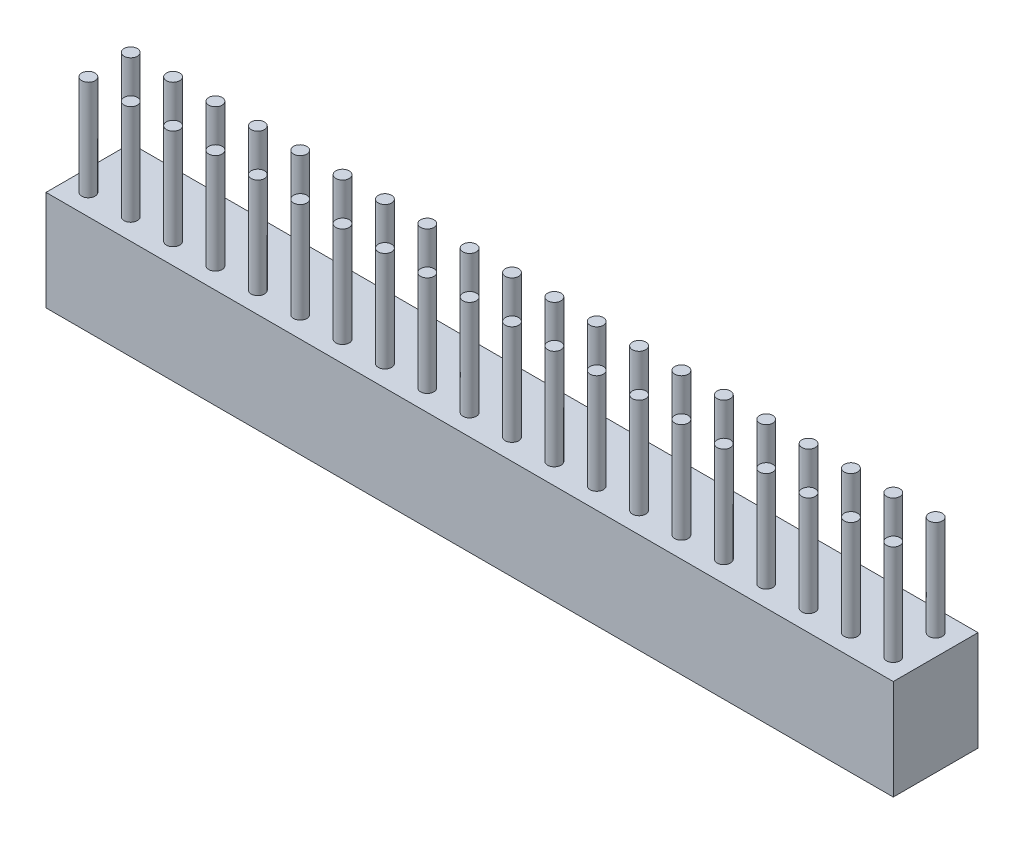
from build123d import *

# Parameters (mm, degrees)
SKETCH1_W             = 2.54
SKETCH1_H             = 2.54
BOSS_EXTRUDE1_DEPTH   = 6
SKETCH2_R             = 0.4
BOSS_EXTRUDE2_DEPTH   = 6
SKETCH3_W             = 1
SKETCH3_H             = 1
CUT_EXTRUDE1_DEPTH    = 3
LPATTERN1_START       = -6
LPATTERN1_OUTLINE_W   = 1
LPATTERN1_OUTLINE_H   = 1
LPATTERN1_DEPTH       = 6
LPATTERN1_START_2     = -3
LPATTERN1_2_OUTLINE_R = 0.4
LPATTERN1_2_DEPTH     = 9
LPATTERN1_3_OUTLINE_W = 1
LPATTERN1_3_OUTLINE_H = 1
LPATTERN1_3_OUTLINE_R = 0.4
LPATTERN1_3_DEPTH     = 3


# Read off the part's stored shape, not the designer's step: LPattern1
with BuildPart() as part:
    # Sketch1 → Boss-Extrude1 (new body)
    with BuildSketch(Plane(origin=(0, 0, 0), x_dir=(1, 0, 0), z_dir=(0, 1, 0))):
        Rectangle(SKETCH1_W, SKETCH1_H)
    extrude(amount=-BOSS_EXTRUDE1_DEPTH)

    # Sketch2 → Boss-Extrude2 (add)
    with BuildSketch(Plane(origin=(0, 0, 0), x_dir=(1, 0, 0), z_dir=(0, 1, 0))):
        with Locations(Location((0, 0, 0), (0, 0, 270))):
            Circle(SKETCH2_R)
    extrude(amount=BOSS_EXTRUDE2_DEPTH)

    # Sketch3 → Cut-Extrude1 (cut)
    with BuildSketch(Plane.XZ.offset(6)):
        Rectangle(SKETCH3_W, SKETCH3_H)
    extrude(amount=-CUT_EXTRUDE1_DEPTH, mode=Mode.SUBTRACT)

    # LPattern1 outline → LPattern1 (add)
    with BuildSketch(Plane(origin=(0, 0, 0), x_dir=(1, 0, 0), z_dir=(0, 1, 0)).offset(LPATTERN1_START)):
        Polygon((-1.27, -1.27), (-1.27, -3.81), (49.53, -3.81), (49.53, 1.27), (1.27, 1.27), (1.27, -1.27), align=None)
        with Locations((0, -2.54)):
            Rectangle(LPATTERN1_OUTLINE_W, LPATTERN1_OUTLINE_H, mode=Mode.SUBTRACT)
        with Locations((2.54, -2.54)):
            Rectangle(LPATTERN1_OUTLINE_W, LPATTERN1_OUTLINE_H, mode=Mode.SUBTRACT)
        with Locations((5.08, -2.54)):
            Rectangle(LPATTERN1_OUTLINE_W, LPATTERN1_OUTLINE_H, mode=Mode.SUBTRACT)
        with Locations((7.62, -2.54)):
            Rectangle(LPATTERN1_OUTLINE_W, LPATTERN1_OUTLINE_H, mode=Mode.SUBTRACT)
        with Locations((10.16, -2.54)):
            Rectangle(LPATTERN1_OUTLINE_W, LPATTERN1_OUTLINE_H, mode=Mode.SUBTRACT)
        with Locations((12.7, -2.54)):
            Rectangle(LPATTERN1_OUTLINE_W, LPATTERN1_OUTLINE_H, mode=Mode.SUBTRACT)
        with Locations((15.24, -2.54)):
            Rectangle(LPATTERN1_OUTLINE_W, LPATTERN1_OUTLINE_H, mode=Mode.SUBTRACT)
        with Locations((17.78, -2.54)):
            Rectangle(LPATTERN1_OUTLINE_W, LPATTERN1_OUTLINE_H, mode=Mode.SUBTRACT)
        with Locations((20.32, -2.54)):
            Rectangle(LPATTERN1_OUTLINE_W, LPATTERN1_OUTLINE_H, mode=Mode.SUBTRACT)
        with Locations((22.86, -2.54)):
            Rectangle(LPATTERN1_OUTLINE_W, LPATTERN1_OUTLINE_H, mode=Mode.SUBTRACT)
        with Locations((25.4, -2.54)):
            Rectangle(LPATTERN1_OUTLINE_W, LPATTERN1_OUTLINE_H, mode=Mode.SUBTRACT)
        with Locations((27.94, -2.54)):
            Rectangle(LPATTERN1_OUTLINE_W, LPATTERN1_OUTLINE_H, mode=Mode.SUBTRACT)
        with Locations((30.48, -2.54)):
            Rectangle(LPATTERN1_OUTLINE_W, LPATTERN1_OUTLINE_H, mode=Mode.SUBTRACT)
        with Locations((33.02, -2.54)):
            Rectangle(LPATTERN1_OUTLINE_W, LPATTERN1_OUTLINE_H, mode=Mode.SUBTRACT)
        with Locations((35.56, -2.54)):
            Rectangle(LPATTERN1_OUTLINE_W, LPATTERN1_OUTLINE_H, mode=Mode.SUBTRACT)
        with Locations((38.1, -2.54)):
            Rectangle(LPATTERN1_OUTLINE_W, LPATTERN1_OUTLINE_H, mode=Mode.SUBTRACT)
        with Locations((40.64, -2.54)):
            Rectangle(LPATTERN1_OUTLINE_W, LPATTERN1_OUTLINE_H, mode=Mode.SUBTRACT)
        with Locations((43.18, -2.54)):
            Rectangle(LPATTERN1_OUTLINE_W, LPATTERN1_OUTLINE_H, mode=Mode.SUBTRACT)
        with Locations((45.72, -2.54)):
            Rectangle(LPATTERN1_OUTLINE_W, LPATTERN1_OUTLINE_H, mode=Mode.SUBTRACT)
        with Locations((48.26, -2.54)):
            Rectangle(LPATTERN1_OUTLINE_W, LPATTERN1_OUTLINE_H, mode=Mode.SUBTRACT)
        with Locations((2.54, 0)):
            Rectangle(LPATTERN1_OUTLINE_W, LPATTERN1_OUTLINE_H, mode=Mode.SUBTRACT)
        with Locations((5.08, 0)):
            Rectangle(LPATTERN1_OUTLINE_W, LPATTERN1_OUTLINE_H, mode=Mode.SUBTRACT)
        with Locations((7.62, 0)):
            Rectangle(LPATTERN1_OUTLINE_W, LPATTERN1_OUTLINE_H, mode=Mode.SUBTRACT)
        with Locations((10.16, 0)):
            Rectangle(LPATTERN1_OUTLINE_W, LPATTERN1_OUTLINE_H, mode=Mode.SUBTRACT)
        with Locations((12.7, 0)):
            Rectangle(LPATTERN1_OUTLINE_W, LPATTERN1_OUTLINE_H, mode=Mode.SUBTRACT)
        with Locations((15.24, 0)):
            Rectangle(LPATTERN1_OUTLINE_W, LPATTERN1_OUTLINE_H, mode=Mode.SUBTRACT)
        with Locations((17.78, 0)):
            Rectangle(LPATTERN1_OUTLINE_W, LPATTERN1_OUTLINE_H, mode=Mode.SUBTRACT)
        with Locations((20.32, 0)):
            Rectangle(LPATTERN1_OUTLINE_W, LPATTERN1_OUTLINE_H, mode=Mode.SUBTRACT)
        with Locations((22.86, 0)):
            Rectangle(LPATTERN1_OUTLINE_W, LPATTERN1_OUTLINE_H, mode=Mode.SUBTRACT)
        with Locations((25.4, 0)):
            Rectangle(LPATTERN1_OUTLINE_W, LPATTERN1_OUTLINE_H, mode=Mode.SUBTRACT)
        with Locations((27.94, 0)):
            Rectangle(LPATTERN1_OUTLINE_W, LPATTERN1_OUTLINE_H, mode=Mode.SUBTRACT)
        with Locations((30.48, 0)):
            Rectangle(LPATTERN1_OUTLINE_W, LPATTERN1_OUTLINE_H, mode=Mode.SUBTRACT)
        with Locations((33.02, 0)):
            Rectangle(LPATTERN1_OUTLINE_W, LPATTERN1_OUTLINE_H, mode=Mode.SUBTRACT)
        with Locations((35.56, 0)):
            Rectangle(LPATTERN1_OUTLINE_W, LPATTERN1_OUTLINE_H, mode=Mode.SUBTRACT)
        with Locations((38.1, 0)):
            Rectangle(LPATTERN1_OUTLINE_W, LPATTERN1_OUTLINE_H, mode=Mode.SUBTRACT)
        with Locations((40.64, 0)):
            Rectangle(LPATTERN1_OUTLINE_W, LPATTERN1_OUTLINE_H, mode=Mode.SUBTRACT)
        with Locations((43.18, 0)):
            Rectangle(LPATTERN1_OUTLINE_W, LPATTERN1_OUTLINE_H, mode=Mode.SUBTRACT)
        with Locations((45.72, 0)):
            Rectangle(LPATTERN1_OUTLINE_W, LPATTERN1_OUTLINE_H, mode=Mode.SUBTRACT)
        with Locations((48.26, 0)):
            Rectangle(LPATTERN1_OUTLINE_W, LPATTERN1_OUTLINE_H, mode=Mode.SUBTRACT)
    extrude(amount=LPATTERN1_DEPTH)



with BuildPart() as body_2:
    # LPattern1 2 outline → LPattern1 2 (new body)
    with BuildSketch(Plane(origin=(0, 0, 0), x_dir=(1, 0, 0), z_dir=(0, 1, 0)).offset(LPATTERN1_START_2)):
        with Locations((48.26, -2.54)):
            Circle(LPATTERN1_2_OUTLINE_R)
        with Locations((45.72, -2.54)):
            Circle(LPATTERN1_2_OUTLINE_R)
        with Locations((43.18, -2.54)):
            Circle(LPATTERN1_2_OUTLINE_R)
        with Locations((40.64, -2.54)):
            Circle(LPATTERN1_2_OUTLINE_R)
        with Locations((38.1, -2.54)):
            Circle(LPATTERN1_2_OUTLINE_R)
        with Locations((35.56, -2.54)):
            Circle(LPATTERN1_2_OUTLINE_R)
        with Locations((33.02, -2.54)):
            Circle(LPATTERN1_2_OUTLINE_R)
        with Locations((30.48, -2.54)):
            Circle(LPATTERN1_2_OUTLINE_R)
        with Locations((27.94, -2.54)):
            Circle(LPATTERN1_2_OUTLINE_R)
        with Locations((25.4, -2.54)):
            Circle(LPATTERN1_2_OUTLINE_R)
        with Locations((22.86, -2.54)):
            Circle(LPATTERN1_2_OUTLINE_R)
        with Locations((20.32, -2.54)):
            Circle(LPATTERN1_2_OUTLINE_R)
        with Locations((17.78, -2.54)):
            Circle(LPATTERN1_2_OUTLINE_R)
        with Locations((15.24, -2.54)):
            Circle(LPATTERN1_2_OUTLINE_R)
        with Locations((12.7, -2.54)):
            Circle(LPATTERN1_2_OUTLINE_R)
        with Locations((10.16, -2.54)):
            Circle(LPATTERN1_2_OUTLINE_R)
        with Locations((7.62, -2.54)):
            Circle(LPATTERN1_2_OUTLINE_R)
        with Locations((5.08, -2.54)):
            Circle(LPATTERN1_2_OUTLINE_R)
        with Locations((2.54, -2.54)):
            Circle(LPATTERN1_2_OUTLINE_R)
        with Locations((0, -2.54)):
            Circle(LPATTERN1_2_OUTLINE_R)
        with Locations((48.26, 0)):
            Circle(LPATTERN1_2_OUTLINE_R)
        with Locations((45.72, 0)):
            Circle(LPATTERN1_2_OUTLINE_R)
        with Locations((43.18, 0)):
            Circle(LPATTERN1_2_OUTLINE_R)
        with Locations((40.64, 0)):
            Circle(LPATTERN1_2_OUTLINE_R)
        with Locations((38.1, 0)):
            Circle(LPATTERN1_2_OUTLINE_R)
        with Locations((35.56, 0)):
            Circle(LPATTERN1_2_OUTLINE_R)
        with Locations((33.02, 0)):
            Circle(LPATTERN1_2_OUTLINE_R)
        with Locations((30.48, 0)):
            Circle(LPATTERN1_2_OUTLINE_R)
        with Locations((27.94, 0)):
            Circle(LPATTERN1_2_OUTLINE_R)
        with Locations((25.4, 0)):
            Circle(LPATTERN1_2_OUTLINE_R)
        with Locations((22.86, 0)):
            Circle(LPATTERN1_2_OUTLINE_R)
        with Locations((20.32, 0)):
            Circle(LPATTERN1_2_OUTLINE_R)
        with Locations((17.78, 0)):
            Circle(LPATTERN1_2_OUTLINE_R)
        with Locations((15.24, 0)):
            Circle(LPATTERN1_2_OUTLINE_R)
        with Locations((12.7, 0)):
            Circle(LPATTERN1_2_OUTLINE_R)
        with Locations((10.16, 0)):
            Circle(LPATTERN1_2_OUTLINE_R)
        with Locations((7.62, 0)):
            Circle(LPATTERN1_2_OUTLINE_R)
        with Locations((5.08, 0)):
            Circle(LPATTERN1_2_OUTLINE_R)
        with Locations((2.54, 0)):
            Circle(LPATTERN1_2_OUTLINE_R)
    extrude(amount=LPATTERN1_2_DEPTH)


with BuildPart() as part_1:
    add(part.part)

    add(body_2.part)  # LPattern1 3 merges body 2
    # LPattern1 3 outline → LPattern1 3 (add)
    # profile 1 of 39: a face of its own
    with BuildSketch(Plane(origin=(0, 0, 0), x_dir=(1, 0, 0), z_dir=(0, 1, 0)).offset(LPATTERN1_START_2)):
        with Locations((0, -2.54)):
            Rectangle(LPATTERN1_3_OUTLINE_W, LPATTERN1_3_OUTLINE_H)
        with Locations((0, -2.54)):
            Circle(LPATTERN1_3_OUTLINE_R, mode=Mode.SUBTRACT)
    # profile 2 of 39: a face of its own
    with BuildSketch(Plane(origin=(0, 0, 0), x_dir=(1, 0, 0), z_dir=(0, 1, 0)).offset(LPATTERN1_START_2)):
        with Locations((48.26, 0)):
            Rectangle(LPATTERN1_3_OUTLINE_W, LPATTERN1_3_OUTLINE_H)
        with Locations((48.26, 0)):
            Circle(LPATTERN1_3_OUTLINE_R, mode=Mode.SUBTRACT)
    # profile 3 of 39: a face of its own
    with BuildSketch(Plane(origin=(0, 0, 0), x_dir=(1, 0, 0), z_dir=(0, 1, 0)).offset(LPATTERN1_START_2)):
        with Locations((45.72, 0)):
            Rectangle(LPATTERN1_3_OUTLINE_W, LPATTERN1_3_OUTLINE_H)
        with Locations((45.72, 0)):
            Circle(LPATTERN1_3_OUTLINE_R, mode=Mode.SUBTRACT)
    # profile 4 of 39: a face of its own
    with BuildSketch(Plane(origin=(0, 0, 0), x_dir=(1, 0, 0), z_dir=(0, 1, 0)).offset(LPATTERN1_START_2)):
        with Locations((43.18, 0)):
            Rectangle(LPATTERN1_3_OUTLINE_W, LPATTERN1_3_OUTLINE_H)
        with Locations((43.18, 0)):
            Circle(LPATTERN1_3_OUTLINE_R, mode=Mode.SUBTRACT)
    # profile 5 of 39: a face of its own
    with BuildSketch(Plane(origin=(0, 0, 0), x_dir=(1, 0, 0), z_dir=(0, 1, 0)).offset(LPATTERN1_START_2)):
        with Locations((40.64, 0)):
            Rectangle(LPATTERN1_3_OUTLINE_W, LPATTERN1_3_OUTLINE_H)
        with Locations((40.64, 0)):
            Circle(LPATTERN1_3_OUTLINE_R, mode=Mode.SUBTRACT)
    # profile 6 of 39: a face of its own
    with BuildSketch(Plane(origin=(0, 0, 0), x_dir=(1, 0, 0), z_dir=(0, 1, 0)).offset(LPATTERN1_START_2)):
        with Locations((38.1, 0)):
            Rectangle(LPATTERN1_3_OUTLINE_W, LPATTERN1_3_OUTLINE_H)
        with Locations((38.1, 0)):
            Circle(LPATTERN1_3_OUTLINE_R, mode=Mode.SUBTRACT)
    # profile 7 of 39: a face of its own
    with BuildSketch(Plane(origin=(0, 0, 0), x_dir=(1, 0, 0), z_dir=(0, 1, 0)).offset(LPATTERN1_START_2)):
        with Locations((35.56, 0)):
            Rectangle(LPATTERN1_3_OUTLINE_W, LPATTERN1_3_OUTLINE_H)
        with Locations((35.56, 0)):
            Circle(LPATTERN1_3_OUTLINE_R, mode=Mode.SUBTRACT)
    # profile 8 of 39: a face of its own
    with BuildSketch(Plane(origin=(0, 0, 0), x_dir=(1, 0, 0), z_dir=(0, 1, 0)).offset(LPATTERN1_START_2)):
        with Locations((33.02, 0)):
            Rectangle(LPATTERN1_3_OUTLINE_W, LPATTERN1_3_OUTLINE_H)
        with Locations((33.02, 0)):
            Circle(LPATTERN1_3_OUTLINE_R, mode=Mode.SUBTRACT)
    # profile 9 of 39: a face of its own
    with BuildSketch(Plane(origin=(0, 0, 0), x_dir=(1, 0, 0), z_dir=(0, 1, 0)).offset(LPATTERN1_START_2)):
        with Locations((30.48, 0)):
            Rectangle(LPATTERN1_3_OUTLINE_W, LPATTERN1_3_OUTLINE_H)
        with Locations((30.48, 0)):
            Circle(LPATTERN1_3_OUTLINE_R, mode=Mode.SUBTRACT)
    # profile 10 of 39: a face of its own
    with BuildSketch(Plane(origin=(0, 0, 0), x_dir=(1, 0, 0), z_dir=(0, 1, 0)).offset(LPATTERN1_START_2)):
        with Locations((27.94, 0)):
            Rectangle(LPATTERN1_3_OUTLINE_W, LPATTERN1_3_OUTLINE_H)
        with Locations((27.94, 0)):
            Circle(LPATTERN1_3_OUTLINE_R, mode=Mode.SUBTRACT)
    # profile 11 of 39: a face of its own
    with BuildSketch(Plane(origin=(0, 0, 0), x_dir=(1, 0, 0), z_dir=(0, 1, 0)).offset(LPATTERN1_START_2)):
        with Locations((25.4, 0)):
            Rectangle(LPATTERN1_3_OUTLINE_W, LPATTERN1_3_OUTLINE_H)
        with Locations((25.4, 0)):
            Circle(LPATTERN1_3_OUTLINE_R, mode=Mode.SUBTRACT)
    # profile 12 of 39: a face of its own
    with BuildSketch(Plane(origin=(0, 0, 0), x_dir=(1, 0, 0), z_dir=(0, 1, 0)).offset(LPATTERN1_START_2)):
        with Locations((22.86, 0)):
            Rectangle(LPATTERN1_3_OUTLINE_W, LPATTERN1_3_OUTLINE_H)
        with Locations((22.86, 0)):
            Circle(LPATTERN1_3_OUTLINE_R, mode=Mode.SUBTRACT)
    # profile 13 of 39: a face of its own
    with BuildSketch(Plane(origin=(0, 0, 0), x_dir=(1, 0, 0), z_dir=(0, 1, 0)).offset(LPATTERN1_START_2)):
        with Locations((20.32, 0)):
            Rectangle(LPATTERN1_3_OUTLINE_W, LPATTERN1_3_OUTLINE_H)
        with Locations((20.32, 0)):
            Circle(LPATTERN1_3_OUTLINE_R, mode=Mode.SUBTRACT)
    # profile 14 of 39: a face of its own
    with BuildSketch(Plane(origin=(0, 0, 0), x_dir=(1, 0, 0), z_dir=(0, 1, 0)).offset(LPATTERN1_START_2)):
        with Locations((17.78, 0)):
            Rectangle(LPATTERN1_3_OUTLINE_W, LPATTERN1_3_OUTLINE_H)
        with Locations((17.78, 0)):
            Circle(LPATTERN1_3_OUTLINE_R, mode=Mode.SUBTRACT)
    # profile 15 of 39: a face of its own
    with BuildSketch(Plane(origin=(0, 0, 0), x_dir=(1, 0, 0), z_dir=(0, 1, 0)).offset(LPATTERN1_START_2)):
        with Locations((15.24, 0)):
            Rectangle(LPATTERN1_3_OUTLINE_W, LPATTERN1_3_OUTLINE_H)
        with Locations((15.24, 0)):
            Circle(LPATTERN1_3_OUTLINE_R, mode=Mode.SUBTRACT)
    # profile 16 of 39: a face of its own
    with BuildSketch(Plane(origin=(0, 0, 0), x_dir=(1, 0, 0), z_dir=(0, 1, 0)).offset(LPATTERN1_START_2)):
        with Locations((12.7, 0)):
            Rectangle(LPATTERN1_3_OUTLINE_W, LPATTERN1_3_OUTLINE_H)
        with Locations((12.7, 0)):
            Circle(LPATTERN1_3_OUTLINE_R, mode=Mode.SUBTRACT)
    # profile 17 of 39: a face of its own
    with BuildSketch(Plane(origin=(0, 0, 0), x_dir=(1, 0, 0), z_dir=(0, 1, 0)).offset(LPATTERN1_START_2)):
        with Locations((10.16, 0)):
            Rectangle(LPATTERN1_3_OUTLINE_W, LPATTERN1_3_OUTLINE_H)
        with Locations((10.16, 0)):
            Circle(LPATTERN1_3_OUTLINE_R, mode=Mode.SUBTRACT)
    # profile 18 of 39: a face of its own
    with BuildSketch(Plane(origin=(0, 0, 0), x_dir=(1, 0, 0), z_dir=(0, 1, 0)).offset(LPATTERN1_START_2)):
        with Locations((7.62, 0)):
            Rectangle(LPATTERN1_3_OUTLINE_W, LPATTERN1_3_OUTLINE_H)
        with Locations((7.62, 0)):
            Circle(LPATTERN1_3_OUTLINE_R, mode=Mode.SUBTRACT)
    # profile 19 of 39: a face of its own
    with BuildSketch(Plane(origin=(0, 0, 0), x_dir=(1, 0, 0), z_dir=(0, 1, 0)).offset(LPATTERN1_START_2)):
        with Locations((5.08, 0)):
            Rectangle(LPATTERN1_3_OUTLINE_W, LPATTERN1_3_OUTLINE_H)
        with Locations((5.08, 0)):
            Circle(LPATTERN1_3_OUTLINE_R, mode=Mode.SUBTRACT)
    # profile 20 of 39: a face of its own
    with BuildSketch(Plane(origin=(0, 0, 0), x_dir=(1, 0, 0), z_dir=(0, 1, 0)).offset(LPATTERN1_START_2)):
        with Locations((2.54, 0)):
            Rectangle(LPATTERN1_3_OUTLINE_W, LPATTERN1_3_OUTLINE_H)
        with Locations((2.54, 0)):
            Circle(LPATTERN1_3_OUTLINE_R, mode=Mode.SUBTRACT)
    # profile 21 of 39: a face of its own
    with BuildSketch(Plane(origin=(0, 0, 0), x_dir=(1, 0, 0), z_dir=(0, 1, 0)).offset(LPATTERN1_START_2)):
        with Locations((48.26, -2.54)):
            Rectangle(LPATTERN1_3_OUTLINE_W, LPATTERN1_3_OUTLINE_H)
        with Locations((48.26, -2.54)):
            Circle(LPATTERN1_3_OUTLINE_R, mode=Mode.SUBTRACT)
    # profile 22 of 39: a face of its own
    with BuildSketch(Plane(origin=(0, 0, 0), x_dir=(1, 0, 0), z_dir=(0, 1, 0)).offset(LPATTERN1_START_2)):
        with Locations((45.72, -2.54)):
            Rectangle(LPATTERN1_3_OUTLINE_W, LPATTERN1_3_OUTLINE_H)
        with Locations((45.72, -2.54)):
            Circle(LPATTERN1_3_OUTLINE_R, mode=Mode.SUBTRACT)
    # profile 23 of 39: a face of its own
    with BuildSketch(Plane(origin=(0, 0, 0), x_dir=(1, 0, 0), z_dir=(0, 1, 0)).offset(LPATTERN1_START_2)):
        with Locations((43.18, -2.54)):
            Rectangle(LPATTERN1_3_OUTLINE_W, LPATTERN1_3_OUTLINE_H)
        with Locations((43.18, -2.54)):
            Circle(LPATTERN1_3_OUTLINE_R, mode=Mode.SUBTRACT)
    # profile 24 of 39: a face of its own
    with BuildSketch(Plane(origin=(0, 0, 0), x_dir=(1, 0, 0), z_dir=(0, 1, 0)).offset(LPATTERN1_START_2)):
        with Locations((40.64, -2.54)):
            Rectangle(LPATTERN1_3_OUTLINE_W, LPATTERN1_3_OUTLINE_H)
        with Locations((40.64, -2.54)):
            Circle(LPATTERN1_3_OUTLINE_R, mode=Mode.SUBTRACT)
    # profile 25 of 39: a face of its own
    with BuildSketch(Plane(origin=(0, 0, 0), x_dir=(1, 0, 0), z_dir=(0, 1, 0)).offset(LPATTERN1_START_2)):
        with Locations((38.1, -2.54)):
            Rectangle(LPATTERN1_3_OUTLINE_W, LPATTERN1_3_OUTLINE_H)
        with Locations((38.1, -2.54)):
            Circle(LPATTERN1_3_OUTLINE_R, mode=Mode.SUBTRACT)
    # profile 26 of 39: a face of its own
    with BuildSketch(Plane(origin=(0, 0, 0), x_dir=(1, 0, 0), z_dir=(0, 1, 0)).offset(LPATTERN1_START_2)):
        with Locations((35.56, -2.54)):
            Rectangle(LPATTERN1_3_OUTLINE_W, LPATTERN1_3_OUTLINE_H)
        with Locations((35.56, -2.54)):
            Circle(LPATTERN1_3_OUTLINE_R, mode=Mode.SUBTRACT)
    # profile 27 of 39: a face of its own
    with BuildSketch(Plane(origin=(0, 0, 0), x_dir=(1, 0, 0), z_dir=(0, 1, 0)).offset(LPATTERN1_START_2)):
        with Locations((33.02, -2.54)):
            Rectangle(LPATTERN1_3_OUTLINE_W, LPATTERN1_3_OUTLINE_H)
        with Locations((33.02, -2.54)):
            Circle(LPATTERN1_3_OUTLINE_R, mode=Mode.SUBTRACT)
    # profile 28 of 39: a face of its own
    with BuildSketch(Plane(origin=(0, 0, 0), x_dir=(1, 0, 0), z_dir=(0, 1, 0)).offset(LPATTERN1_START_2)):
        with Locations((30.48, -2.54)):
            Rectangle(LPATTERN1_3_OUTLINE_W, LPATTERN1_3_OUTLINE_H)
        with Locations((30.48, -2.54)):
            Circle(LPATTERN1_3_OUTLINE_R, mode=Mode.SUBTRACT)
    # profile 29 of 39: a face of its own
    with BuildSketch(Plane(origin=(0, 0, 0), x_dir=(1, 0, 0), z_dir=(0, 1, 0)).offset(LPATTERN1_START_2)):
        with Locations((27.94, -2.54)):
            Rectangle(LPATTERN1_3_OUTLINE_W, LPATTERN1_3_OUTLINE_H)
        with Locations((27.94, -2.54)):
            Circle(LPATTERN1_3_OUTLINE_R, mode=Mode.SUBTRACT)
    # profile 30 of 39: a face of its own
    with BuildSketch(Plane(origin=(0, 0, 0), x_dir=(1, 0, 0), z_dir=(0, 1, 0)).offset(LPATTERN1_START_2)):
        with Locations((25.4, -2.54)):
            Rectangle(LPATTERN1_3_OUTLINE_W, LPATTERN1_3_OUTLINE_H)
        with Locations((25.4, -2.54)):
            Circle(LPATTERN1_3_OUTLINE_R, mode=Mode.SUBTRACT)
    # profile 31 of 39: a face of its own
    with BuildSketch(Plane(origin=(0, 0, 0), x_dir=(1, 0, 0), z_dir=(0, 1, 0)).offset(LPATTERN1_START_2)):
        with Locations((22.86, -2.54)):
            Rectangle(LPATTERN1_3_OUTLINE_W, LPATTERN1_3_OUTLINE_H)
        with Locations((22.86, -2.54)):
            Circle(LPATTERN1_3_OUTLINE_R, mode=Mode.SUBTRACT)
    # profile 32 of 39: a face of its own
    with BuildSketch(Plane(origin=(0, 0, 0), x_dir=(1, 0, 0), z_dir=(0, 1, 0)).offset(LPATTERN1_START_2)):
        with Locations((20.32, -2.54)):
            Rectangle(LPATTERN1_3_OUTLINE_W, LPATTERN1_3_OUTLINE_H)
        with Locations((20.32, -2.54)):
            Circle(LPATTERN1_3_OUTLINE_R, mode=Mode.SUBTRACT)
    # profile 33 of 39: a face of its own
    with BuildSketch(Plane(origin=(0, 0, 0), x_dir=(1, 0, 0), z_dir=(0, 1, 0)).offset(LPATTERN1_START_2)):
        with Locations((17.78, -2.54)):
            Rectangle(LPATTERN1_3_OUTLINE_W, LPATTERN1_3_OUTLINE_H)
        with Locations((17.78, -2.54)):
            Circle(LPATTERN1_3_OUTLINE_R, mode=Mode.SUBTRACT)
    # profile 34 of 39: a face of its own
    with BuildSketch(Plane(origin=(0, 0, 0), x_dir=(1, 0, 0), z_dir=(0, 1, 0)).offset(LPATTERN1_START_2)):
        with Locations((15.24, -2.54)):
            Rectangle(LPATTERN1_3_OUTLINE_W, LPATTERN1_3_OUTLINE_H)
        with Locations((15.24, -2.54)):
            Circle(LPATTERN1_3_OUTLINE_R, mode=Mode.SUBTRACT)
    # profile 35 of 39: a face of its own
    with BuildSketch(Plane(origin=(0, 0, 0), x_dir=(1, 0, 0), z_dir=(0, 1, 0)).offset(LPATTERN1_START_2)):
        with Locations((12.7, -2.54)):
            Rectangle(LPATTERN1_3_OUTLINE_W, LPATTERN1_3_OUTLINE_H)
        with Locations((12.7, -2.54)):
            Circle(LPATTERN1_3_OUTLINE_R, mode=Mode.SUBTRACT)
    # profile 36 of 39: a face of its own
    with BuildSketch(Plane(origin=(0, 0, 0), x_dir=(1, 0, 0), z_dir=(0, 1, 0)).offset(LPATTERN1_START_2)):
        with Locations((10.16, -2.54)):
            Rectangle(LPATTERN1_3_OUTLINE_W, LPATTERN1_3_OUTLINE_H)
        with Locations((10.16, -2.54)):
            Circle(LPATTERN1_3_OUTLINE_R, mode=Mode.SUBTRACT)
    # profile 37 of 39: a face of its own
    with BuildSketch(Plane(origin=(0, 0, 0), x_dir=(1, 0, 0), z_dir=(0, 1, 0)).offset(LPATTERN1_START_2)):
        with Locations((7.62, -2.54)):
            Rectangle(LPATTERN1_3_OUTLINE_W, LPATTERN1_3_OUTLINE_H)
        with Locations((7.62, -2.54)):
            Circle(LPATTERN1_3_OUTLINE_R, mode=Mode.SUBTRACT)
    # profile 38 of 39: a face of its own
    with BuildSketch(Plane(origin=(0, 0, 0), x_dir=(1, 0, 0), z_dir=(0, 1, 0)).offset(LPATTERN1_START_2)):
        with Locations((5.08, -2.54)):
            Rectangle(LPATTERN1_3_OUTLINE_W, LPATTERN1_3_OUTLINE_H)
        with Locations((5.08, -2.54)):
            Circle(LPATTERN1_3_OUTLINE_R, mode=Mode.SUBTRACT)
    # profile 39 of 39: a face of its own
    with BuildSketch(Plane(origin=(0, 0, 0), x_dir=(1, 0, 0), z_dir=(0, 1, 0)).offset(LPATTERN1_START_2)):
        with Locations((2.54, -2.54)):
            Rectangle(LPATTERN1_3_OUTLINE_W, LPATTERN1_3_OUTLINE_H)
        with Locations((2.54, -2.54)):
            Circle(LPATTERN1_3_OUTLINE_R, mode=Mode.SUBTRACT)
    extrude(amount=LPATTERN1_3_DEPTH)


solid = part_1.part
